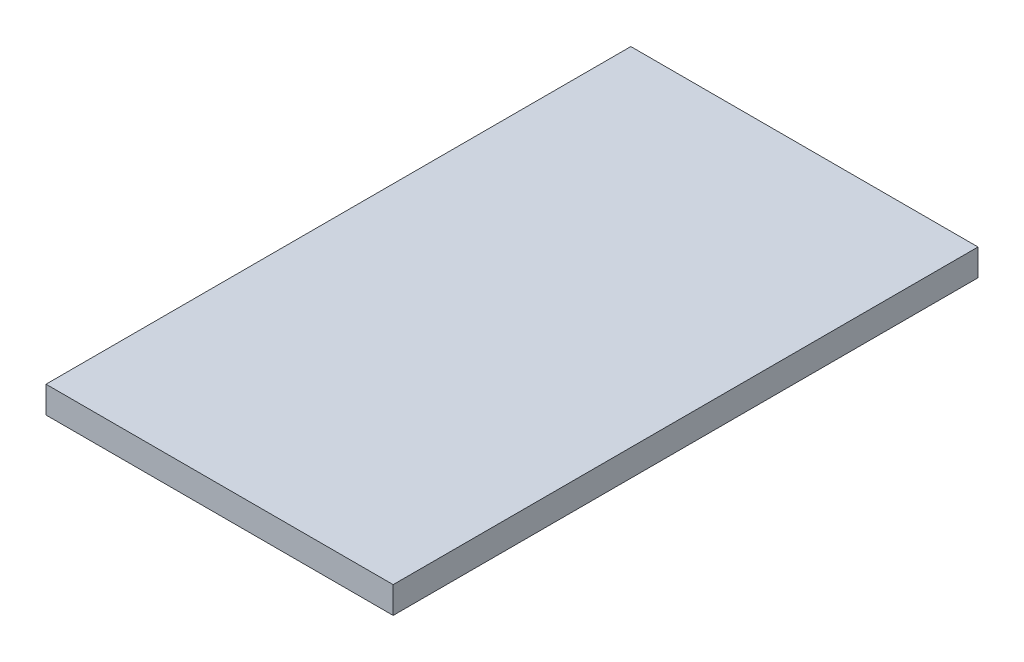
from build123d import *

# Parameters (mm, degrees)
SKETCH2_W           = 13
SKETCH2_H           = 21.9
BOSS_EXTRUDE4_DEPTH = 1


with BuildPart() as part:
    # Sketch2 → Boss-Extrude4 (new body)
    with BuildSketch(Plane(origin=(0, 0, 0), x_dir=(1, 0, 0), z_dir=(0, 1, 0))):
        Rectangle(SKETCH2_W, SKETCH2_H)
    extrude(amount=BOSS_EXTRUDE4_DEPTH)


solid = part.part
